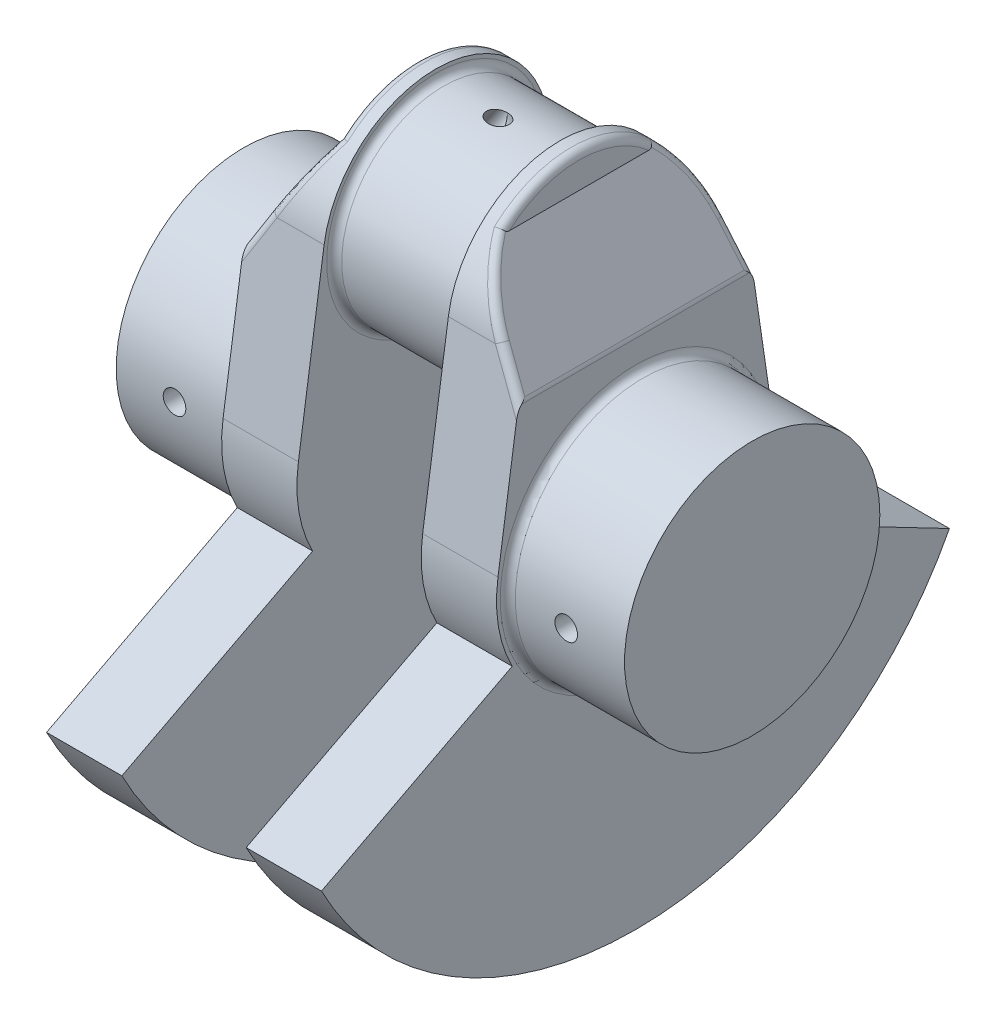
from build123d import *

# Parameters (mm, degrees)
SKETCH_3_R             = 33.9
EXTRUDE_1_DEPTH        = 31
EXTRUDE_2_DEPTH        = 20
CUT_EXTRUDE_1_DEPTH    = 136.606270857
FILLET_1_R             = 2
SKETCH_5_R             = 27
EXTRUDE_3_DEPTH        = 16.5
FILLET_2_R             = 2
FILLET_3_R             = 2
SKETCH_8_R             = 3
CUT_EXTRUDE_2_DEPTH    = 143.633483782
CUT_EXTRUDE_3_REACH    = 201.751
SKETCH_10_R            = 2.5
FILLET_1_OF_MIRROR_5_R = 2
FILLET_2_OF_MIRROR_5_R = 2
FILLET_3_OF_MIRROR_5_R = 2


with BuildPart() as part:
    # Эскиз3 → Бобышка-Вытянуть1 (new body)
    with BuildSketch(Plane(origin=(0, 0, 0), x_dir=(0, 0, -1), z_dir=(1, 0, 0))):
        Circle(SKETCH_3_R)
    extrude_1 = extrude(amount=EXTRUDE_1_DEPTH)

    # Эскиз4 → Бобышка-Вытянуть2 (add)
    with BuildSketch(Plane(origin=(31, 0, 0), x_dir=(0, 0, -1), z_dir=(1, 0, 0))):
        with BuildLine():
            Line((-29.681791615, 51.857894737), (-36.508603686, 5.360210526))
            ThreePointArc((-36.508603686, 5.360210526), (-36.386070275, -6.137091326), (-32.730699744, -17.038523828))
            Line((-32.730699744, -17.038523828), (-83.379018319, -43.404369644))
            ThreePointArc((-83.379018319, -43.404369644), (0, -94), (83.379018319, -43.404369644))
            Line((83.379018319, -43.404369644), (32.730699744, -17.038523828))
            ThreePointArc((32.730699744, -17.038523828), (36.386070275, -6.137091326), (36.508603686, 5.360210526))
            Line((36.508603686, 5.360210526), (29.681791615, 51.857894737))
            ThreePointArc((29.681791615, 51.857894737), (0, 77.5), (-29.681791615, 51.857894737))
        make_face()
    extrude_2 = extrude(amount=EXTRUDE_2_DEPTH)

    # Эскиз6 → Вырез-Вытянуть1 (cut, symmetric)
    with BuildSketch(Plane.XY):
        Polygon((31, 77.5), (46, 77.5), (46, 68.5), (31, 42.519237886), align=None)
    cut_extrude_1 = extrude(amount=CUT_EXTRUDE_1_DEPTH, both=True, mode=Mode.SUBTRACT)

    # Скругление1
    fillet_1_edges = [part.edges().sort_by_distance(p)[0] for p in [
        (31, 42.519237886, 0),
        (33.695838023, 47.188566312, -30.367344631),
        (41.495902656, 60.698674559, -26.940582583),
        (33.695838023, 47.188566312, 30.367344631),
        (41.495902656, 60.698674559, 26.940582583),
        (46, 77.5, 0),
    ]]
    fillet(fillet_1_edges, radius=FILLET_1_R)

    # Эскиз5 → Бобышка-Вытянуть3 (add)
    with BuildSketch(Plane(origin=(51, 0, 0), x_dir=(0, 0, -1), z_dir=(1, 0, 0))):
        with Locations((0, 47.5)):
            Circle(SKETCH_5_R)
    extrude_3 = extrude(amount=EXTRUDE_3_DEPTH)

    # Скругление2
    fillet_2_edges = [part.edges().sort_by_distance(p)[0] for p in [
        (51, 47.5, 27),
    ]]
    fillet(fillet_2_edges, radius=FILLET_2_R)

    # Скругление3
    fillet_3_edges = [part.edges().sort_by_distance(p)[0] for p in [
        (31, 0, 33.9),
    ]]
    fillet(fillet_3_edges, radius=FILLET_3_R)

    # Эскиз8 → Вырез-Вытянуть2 (cut, symmetric)
    with BuildSketch(Plane.XY):
        with Locations((15.5, 0)):
            Circle(SKETCH_8_R)
    cut_extrude_2 = extrude(amount=CUT_EXTRUDE_2_DEPTH, both=True, mode=Mode.SUBTRACT)

    # Эскиз10 → Вырез-Вытянуть3 (cut, up to next)
    with BuildSketch(Plane(origin=(67.5, 74.5, 0), x_dir=(0.8200068183364714, -0.5723537523959263, 0), z_dir=(0.5723537523959262, 0.8200068183364713, 0)), mode=Mode.PRIVATE) as cut_extrude_3_sk1:
        Circle(SKETCH_10_R)
    cut_extrude_3_tool1 = extrude(cut_extrude_3_sk1.sketch, amount=-CUT_EXTRUDE_3_REACH, mode=Mode.PRIVATE) & part.part
    cut_extrude_3 = cut_extrude_3_tool1.solids().sort_by_distance((67.5, 74.5, 0))[0]
    add(cut_extrude_3, mode=Mode.SUBTRACT)

    # Зеркальное отражение5: Бобышка-Вытянуть1, Бобышка-Вытянуть2, Вырез-Вытянуть1, Бобышка-Вытянуть3, Вырез-Вытянуть2, Вырез-Вытянуть3 across plane
    add(extrude_1.mirror(Plane(origin=(67.5, 47.5, 0), x_dir=(0, 0, 1), z_dir=(1, 0, 0))))
    add(extrude_2.mirror(Plane(origin=(67.5, 47.5, 0), x_dir=(0, 0, 1), z_dir=(1, 0, 0))))
    add(cut_extrude_1.mirror(Plane(origin=(67.5, 47.5, 0), x_dir=(0, 0, 1), z_dir=(1, 0, 0))), mode=Mode.SUBTRACT)
    add(extrude_3.mirror(Plane(origin=(67.5, 47.5, 0), x_dir=(0, 0, 1), z_dir=(1, 0, 0))))
    add(cut_extrude_2.mirror(Plane(origin=(67.5, 47.5, 0), x_dir=(0, 0, 1), z_dir=(1, 0, 0))), mode=Mode.SUBTRACT)
    add(cut_extrude_3.mirror(Plane(origin=(67.5, 47.5, 0), x_dir=(0, 0, 1), z_dir=(1, 0, 0))), mode=Mode.SUBTRACT)

    # Скругление1 of Зеркальное отражение5
    fillet_1_of_mirror_5_edges = [part.edges().sort_by_distance(p)[0] for p in [
        (104, 42.519237886, 0),
        (101.304161977, 47.188566312, -30.367344631),
        (93.504097344, 60.698674559, -26.940582583),
        (101.304161977, 47.188566312, 30.367344631),
        (93.504097344, 60.698674559, 26.940582583),
        (89, 77.5, 0),
    ]]
    fillet(fillet_1_of_mirror_5_edges, radius=FILLET_1_OF_MIRROR_5_R)

    # Скругление2 of Зеркальное отражение5
    fillet_2_of_mirror_5_edges = [part.edges().sort_by_distance(p)[0] for p in [
        (84, 47.5, 27),
    ]]
    fillet(fillet_2_of_mirror_5_edges, radius=FILLET_2_OF_MIRROR_5_R)

    # Скругление3 of Зеркальное отражение5
    fillet_3_of_mirror_5_edges = [part.edges().sort_by_distance(p)[0] for p in [
        (104, 0, 33.9),
    ]]
    fillet(fillet_3_of_mirror_5_edges, radius=FILLET_3_OF_MIRROR_5_R)


solid = part.part
